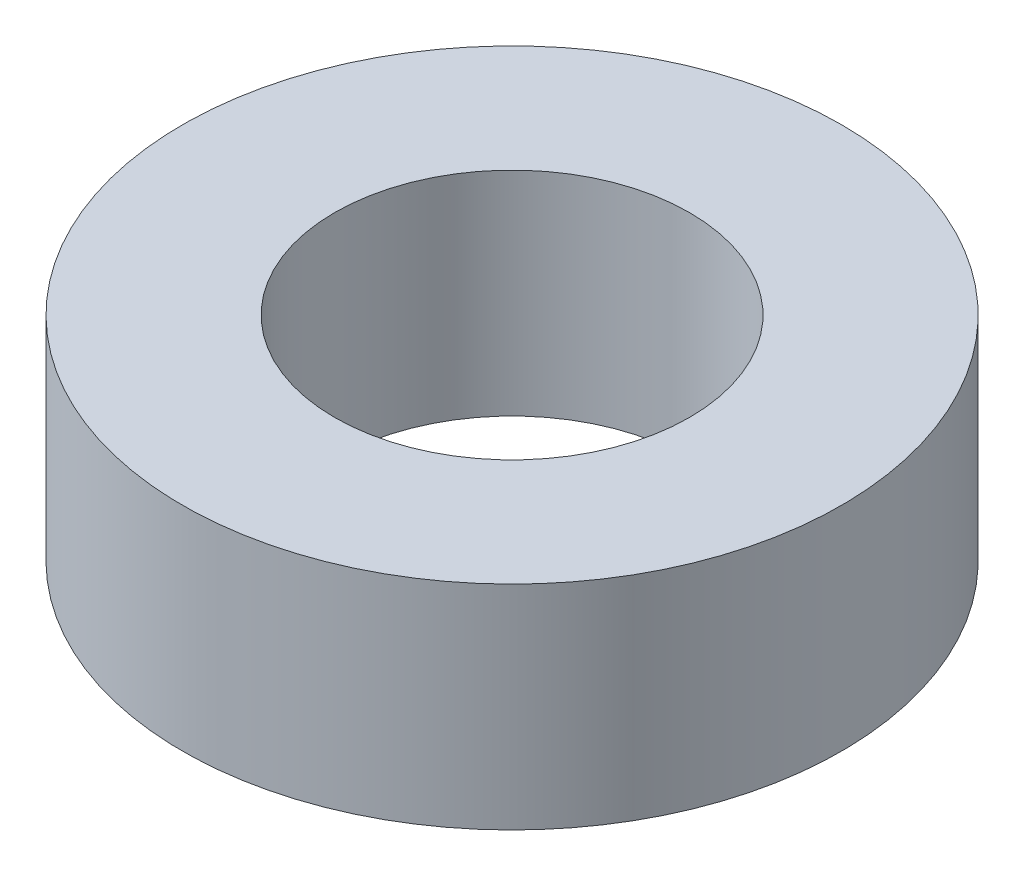
from build123d import *

# Parameters (mm, degrees)
SKETCH1_R           = 32.5
BOSS_EXTRUDE1_DEPTH = 21
SKETCH2_R           = 17.5
CUT_EXTRUDE1_DEPTH  = 51.532167972


with BuildPart() as part:
    # Sketch1 → Boss-Extrude1 (new body)
    with BuildSketch(Plane(origin=(0, 0, 0), x_dir=(1, 0, 0), z_dir=(0, 1, 0))):
        Circle(SKETCH1_R)
    extrude(amount=BOSS_EXTRUDE1_DEPTH)

    # Sketch2 → Cut-Extrude1 (cut, through all)
    with BuildSketch(Plane(origin=(0, 0, 0), x_dir=(1, 0, 0), z_dir=(0, 1, 0))):
        Circle(SKETCH2_R)
    extrude(amount=CUT_EXTRUDE1_DEPTH, mode=Mode.SUBTRACT)


solid = part.part
